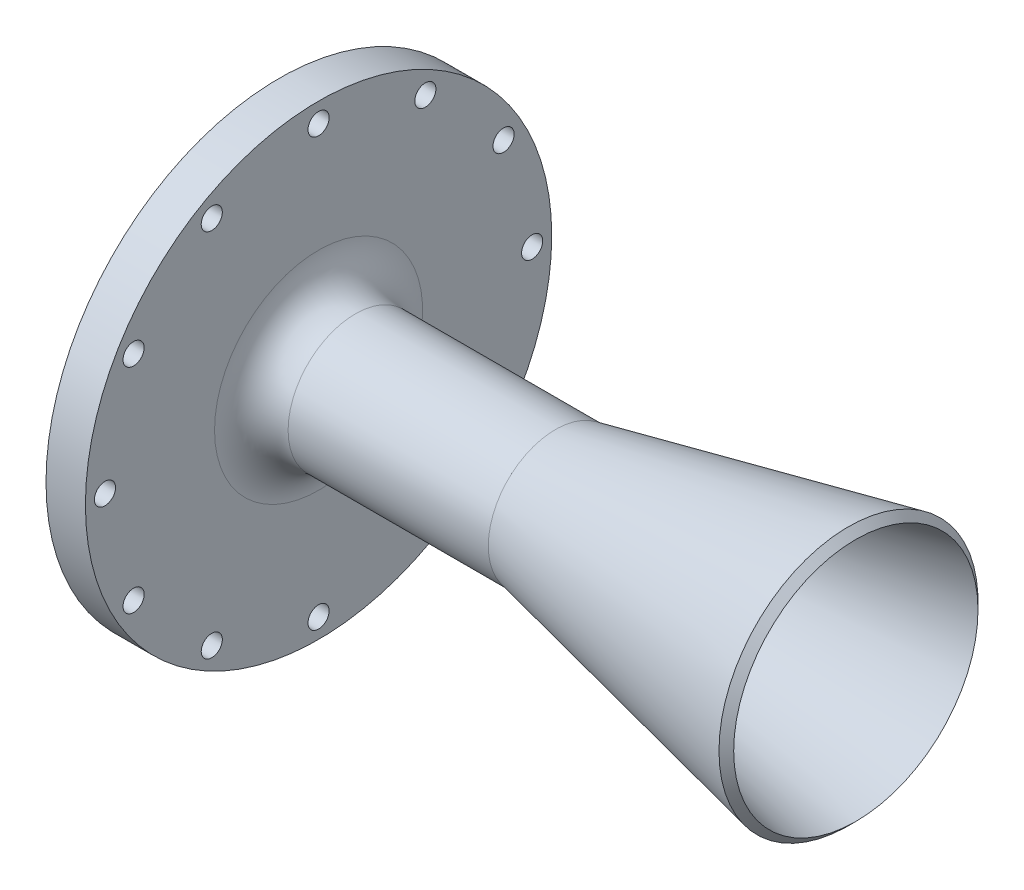
from build123d import *

# Parameters (mm, degrees)
FLANGE_HOLES_D     = 5.1054
DOWEL_HOLES_D      = 4.7625
DOWEL_HOLES_DEPTH  = 6.35
DOWEL_HOLES_TIP    = 1.430799349
FILLET1_R          = 8.89
CHAMFER1_SIZE      = 2.141545552
CHAMFER1_SIZE_2    = 2.54
SKETCH14_R         = 46.2915
SKETCH14_R_2       = 40.9575
CUT_EXTRUDE1_DEPTH = 2.3876


with BuildPart() as part:
    # Sketch2 → Main Structure (revolve)
    with BuildSketch(Plane.XY, mode=Mode.PRIVATE) as main_structure_sk:
        Polygon((0, 20.583496156), (0, 56.35625), (9.525, 56.35625), (9.525, 16.256), (66.806461084, 16.256), (139.7, 31.75), (139.7, 29.592458901), (60.325, 12.720781818), (60.325, 14.351), (10.795, 14.351), align=None)
    revolve(main_structure_sk.sketch.rotate(Axis((0, 0, 0), (1, 0, 0)), 90), axis=Axis((0, 0, 0), (1, 0, 0)))

    # Flange Holes (through all)
    with Locations(Plane.ZY):
        with Locations((0, -51.6255), (-25.81275, -44.708994483), (-44.708994483, -25.81275), (-51.6255, 0), (-44.708994483, 25.81275), (-25.81275, 44.708994483), (0, 51.6255), (25.81275, 44.708994483), (44.708994483, 25.81275), (51.6255, 0), (44.708994483, -25.81275), (25.81275, -44.708994483)):
            Hole(FLANGE_HOLES_D / 2)

    # Dowel Holes
    with Locations(Plane.ZY):
        with Locations((49.866403745, -13.361662613), (-49.866403745, 13.361662613)):
            Hole(DOWEL_HOLES_D / 2, depth=DOWEL_HOLES_DEPTH)
            with Locations((0, 0, -(DOWEL_HOLES_DEPTH + DOWEL_HOLES_TIP / 2))):  # 118° drill point
                Cone(0, DOWEL_HOLES_D / 2, DOWEL_HOLES_TIP, mode=Mode.SUBTRACT)

    # Fillet1
    fillet1_edges = [part.edges().sort_by_distance(p)[0] for p in [
        (9.525, 0, -16.256),
    ]]
    fillet(fillet1_edges, radius=FILLET1_R)

    # Sketch13 → Cut-Revolve1 (revolve, cut)
    with BuildSketch(Plane(origin=(0, 0, 0), x_dir=(1, 0, 0), z_dir=(0, 1, 0)), mode=Mode.PRIVATE) as cut_revolve1_sk:
        Polygon((0, 36), (3.149591887, 0), (0, 0), align=None)
    revolve(cut_revolve1_sk.sketch.rotate(Axis((3.149591887, 0, 0), (-1, 0, 0)), 180), axis=Axis((3.149591887, 0, 0), (-1, 0, 0)), mode=Mode.SUBTRACT)

    # Chamfer1
    # the kernel refuses this chamfer: 2.54, 2.141545552 mm, written as the material it takes off along each edge
    with BuildSketch(Plane(origin=(139.7, 0, 0), x_dir=(0, 0, 1), z_dir=(0, 1, 0))) as chamfer1_piece_1:
        Polygon((31.75 - CHAMFER1_SIZE * 0.207911690799, -CHAMFER1_SIZE * 0.978147600645), (31.75 - CHAMFER1_SIZE_2, 0), (31.75, 0), align=None)
    revolve(axis=Axis((139.7, 0, 0), (1, 0, 0)), mode=Mode.SUBTRACT)

    # Sketch14 → Cut-Extrude1 (cut)
    with BuildSketch(Plane.ZY):
        Circle(SKETCH14_R)
        Circle(SKETCH14_R_2, mode=Mode.SUBTRACT)
    extrude(amount=-CUT_EXTRUDE1_DEPTH, mode=Mode.SUBTRACT)


solid = part.part
